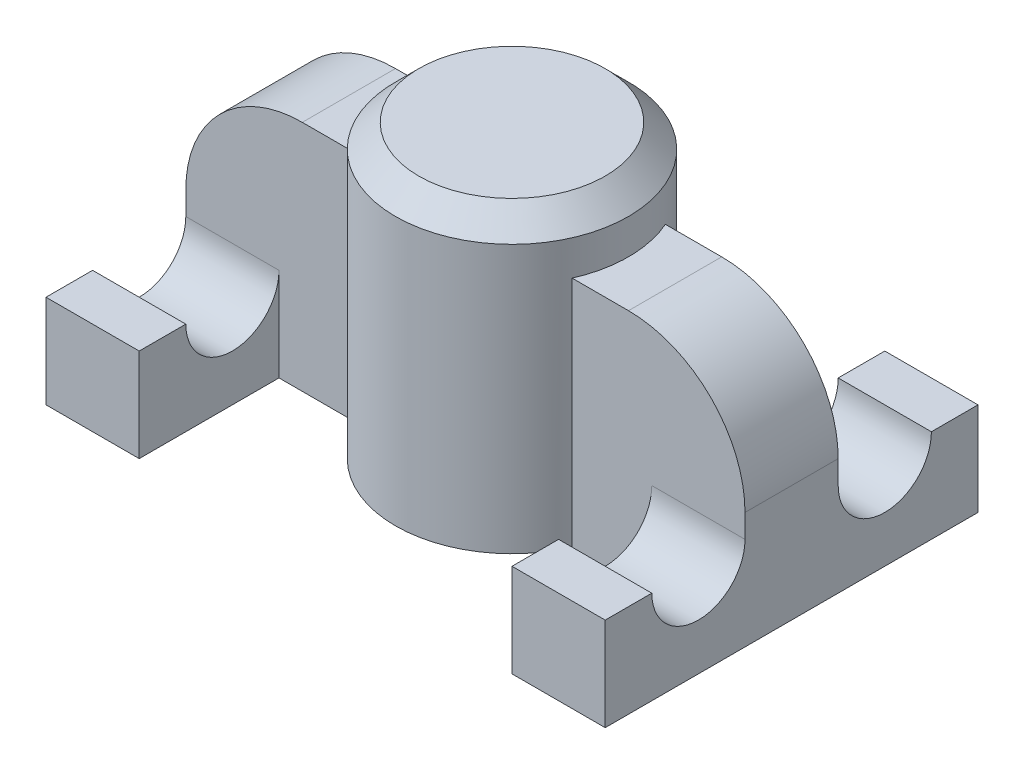
from build123d import *

# Parameters (mm, degrees)
SKETCH1_R                = 10
PEN_CAP_DEPTH            = 25
SKETCH2_W                = 48
SKETCH2_H                = 8
HOOK_STRUCTURE_DEPTH     = 20
PEN_CENTERING_HOLE_D     = 12.5
PEN_CENTERING_HOLE_DEPTH = 15
PEN_CENTERING_HOLE_TIP   = 6.25
HOOKS_DEPTH              = 8
CORNER_DEC_R             = 10
CHAMFER1_SIZE            = 2


with BuildPart() as part:
    # Sketch1 → Pen Cap (new body)
    with BuildSketch(Plane(origin=(0, 0, 0), x_dir=(1, 0, 0), z_dir=(0, 1, 0))):
        Circle(SKETCH1_R)
    extrude(amount=PEN_CAP_DEPTH)

    # Sketch2 → Hook Structure (add)
    with BuildSketch(Plane.XZ):
        Rectangle(SKETCH2_W, SKETCH2_H)
    extrude(amount=-HOOK_STRUCTURE_DEPTH)

    # Pen Centering Hole
    with Locations(Plane.XZ):
        with Locations((0, 0)):
            Hole(PEN_CENTERING_HOLE_D / 2, depth=PEN_CENTERING_HOLE_DEPTH)
            with Locations((0, 0, -(PEN_CENTERING_HOLE_DEPTH + PEN_CENTERING_HOLE_TIP / 2))):  # 90° drill point
                Cone(0, PEN_CENTERING_HOLE_D / 2, PEN_CENTERING_HOLE_TIP, mode=Mode.SUBTRACT)

    # Sketch6 → Hooks (add)
    with BuildSketch(Plane(origin=(24, 0, 0), x_dir=(0, 0, -1), z_dir=(1, 0, 0))):
        with BuildLine():
            Line((-4, 0), (-16, 0))
            Line((-16, 0), (-16, 8))
            Line((-16, 8), (-12, 8))
            ThreePointArc((-12, 8), (-8, 4), (-4, 8))
            Line((-4, 8), (-4, 0))
        make_face()
        with BuildLine():
            Line((4, 8), (4, 0))
            Line((4, 0), (16, 0))
            Line((16, 0), (16, 8))
            Line((16, 8), (12, 8))
            ThreePointArc((12, 8), (8, 4), (4, 8))
        make_face()
    hooks = extrude(amount=-HOOKS_DEPTH)

    # Hook Mirror: Hooks across plane
    add(hooks.mirror(Plane(origin=(0, 0, 0), x_dir=(0, 0, 1), z_dir=(1, 0, 0))))

    # Corner Dec
    corner_dec_edges = [part.edges().sort_by_distance(p)[0] for p in [
        (24, 20, 0),
        (-24, 20, 0),
    ]]
    fillet(corner_dec_edges, radius=CORNER_DEC_R)

    # Chamfer1
    chamfer1_edges = [part.edges().sort_by_distance(p)[0] for p in [
        (-10, 25, 0),
    ]]
    chamfer(chamfer1_edges, length=CHAMFER1_SIZE)


solid = part.part
